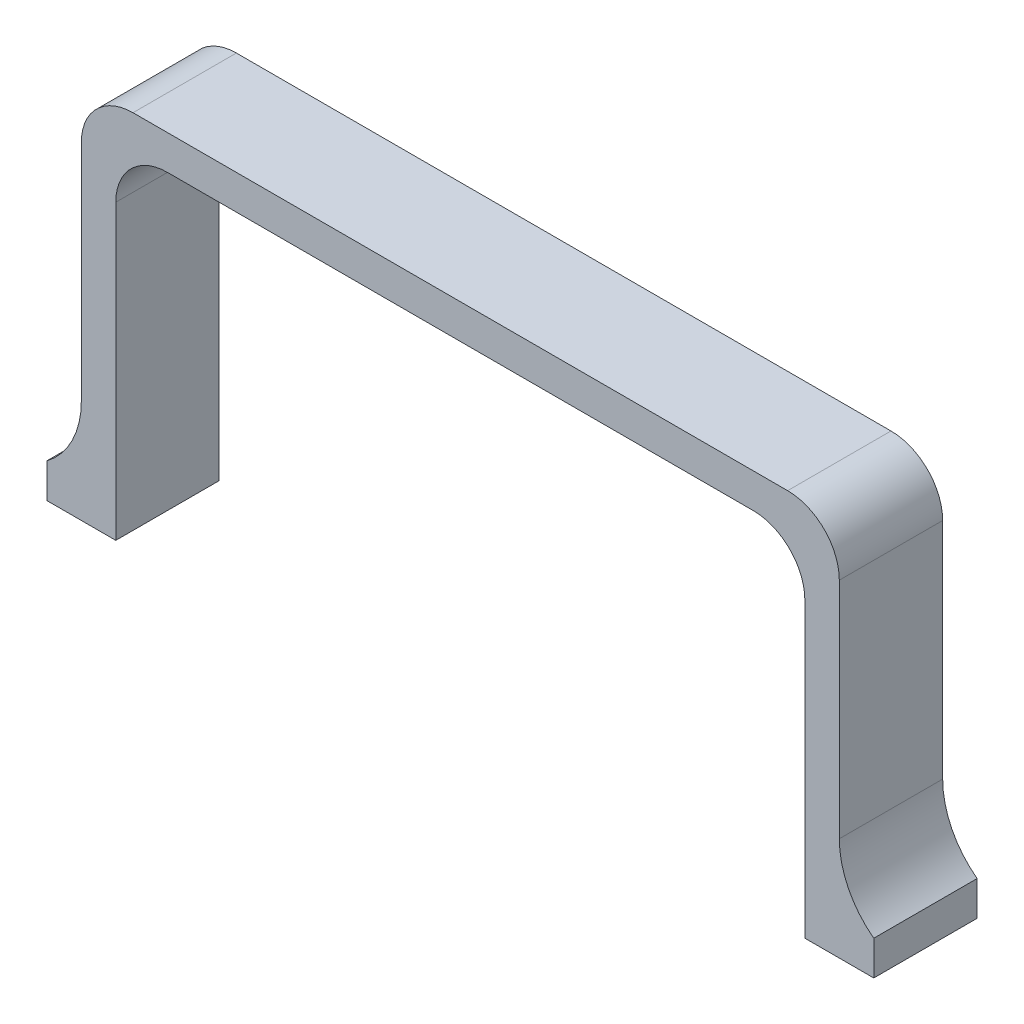
from build123d import *

# Parameters (mm, degrees)
EXTRUDE_1_DEPTH = 6
FILLET_1_R      = 5
FILLET_2_R      = 3


with BuildPart() as part:
    # 草图1 → 凸台-拉伸1 (new body)
    with BuildSketch(Plane.XY):
        Polygon((-20, 0), (20, 0), (20, -20), (24, -20), (24, -18), (22, -18), (22, 2), (-22, 2), (-22, -18), (-24, -18), (-24, -20), (-20, -20), align=None)
    extrude(amount=EXTRUDE_1_DEPTH)

    # 圆角1
    # the kernel refuses this fillet: 5 mm, written as the material it adds along each edge
    with BuildSketch(Plane(origin=(22, -18, 0), x_dir=(1, 0, 0), z_dir=(0, 0, 1))) as fillet_1_piece_1:
        with BuildLine():
            CenterArc((5, 4), FILLET_1_R, 180, 53.130102354)
            Line((0, 4), (-0.1, 4))
            Line((-0.1, 4), (-0.1, 0))
            Line((-0.1, 0), (0, -0.1))
            ThreePointArc((0, -0.1), (1, -0.1), (1.94, -0.08))
            Line((1.94, -0.08), (2, 0))
        make_face()
    extrude(amount=6)
    with BuildSketch(Plane(origin=(-22, -18, 0), x_dir=(0, 1, 0), z_dir=(0, 0, 1))) as fillet_1_piece_2:
        with BuildLine():
            CenterArc((4, 5), FILLET_1_R, 216.869897646, 53.130102354)
            Line((0, 2), (-0.08, 1.94))
            ThreePointArc((-0.08, 1.94), (-0.1, 1), (-0.1, 0))
            Line((-0.1, 0), (0, -0.1))
            Line((0, -0.1), (4, -0.1))
            Line((4, -0.1), (4, 0))
        make_face()
    extrude(amount=6)

    # 圆角2
    fillet_2_edges = [part.edges().sort_by_distance(p)[0] for p in [
        (20, 0, 3),
        (-20, 0, 3),
        (-22, 2, 3),
        (22, 2, 3),
    ]]
    fillet(fillet_2_edges, radius=FILLET_2_R)


solid = part.part
